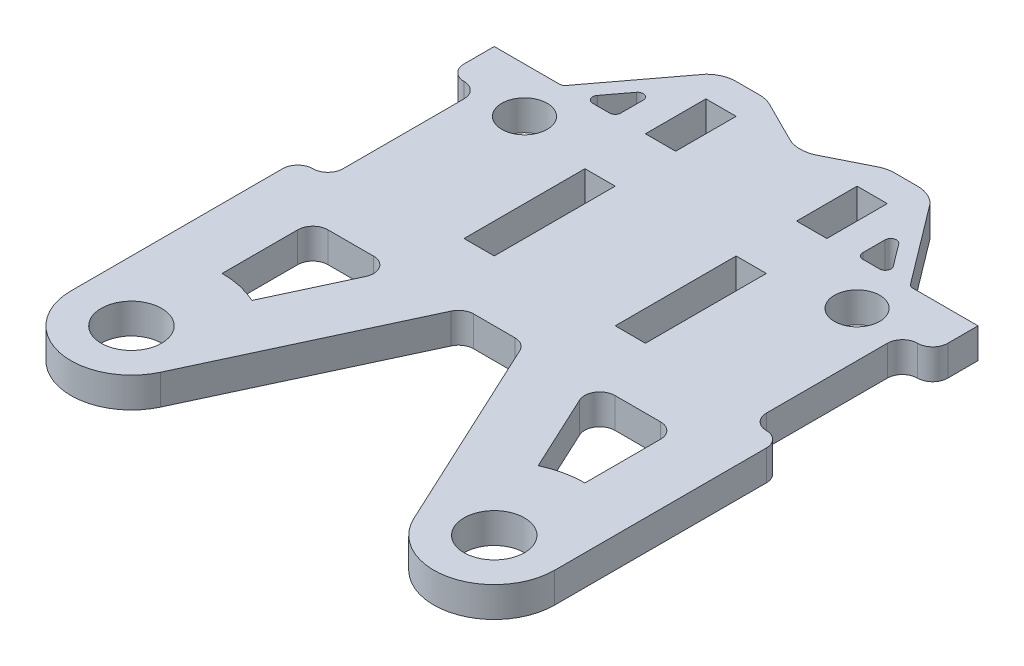
from build123d import *

# Parameters (mm, degrees)
SKETCH1_R           = 3.175
SKETCH1_W           = 3.175
SKETCH1_H           = 12.7
SKETCH1_H_2         = 6.35
BOSS_EXTRUDE1_DEPTH = 3.175
FILLET1_R           = 1.5875
SKETCH2_R           = 2.38125
CUT_EXTRUDE1_DEPTH  = 46.900442536
FILLET2_R           = 3.175
FILLET4_R           = 0.6


with BuildPart() as part:
    # Sketch1 → Boss-Extrude1 (new body)
    with BuildSketch(Plane(origin=(0, 0, 0), x_dir=(1, 0, 0), z_dir=(0, 1, 0))):
        with BuildLine():
            Line((25.4, -31.75), (25.4, -12.7))
            Line((25.4, -12.7), (25.4, -9.525))
            ThreePointArc((25.4, -9.525), (24.935032015, -8.402467985), (23.8125, -7.9375))
            ThreePointArc((23.8125, -7.9375), (22.689967985, -7.472532015), (22.225, -6.35))
            Line((22.225, -6.35), (22.225, 6.35))
            ThreePointArc((22.225, 6.35), (22.689967985, 7.472532015), (23.8125, 7.9375))
            ThreePointArc((23.8125, 7.9375), (24.935032015, 8.402467985), (25.4, 9.525))
            Line((25.4, 9.525), (25.4, 12.7))
            Line((25.4, 12.7), (23.8125, 12.7))
            Line((23.8125, 12.7), (18.25625, 12.7))
            Line((18.25625, 12.7), (11.77006403, 21.29506403))
            ThreePointArc((11.77006403, 21.29506403), (10.740019898, 21.983317516), (9.525, 22.225))
            Line((9.525, 22.225), (6.35, 22.225))
            Line((6.35, 22.225), (0, 19.05))
            Line((0, 19.05), (-6.35, 22.225))
            Line((-6.35, 22.225), (-9.525, 22.225))
            ThreePointArc((-9.525, 22.225), (-10.740019898, 21.983317516), (-11.77006403, 21.29506403))
            Line((-11.77006403, 21.29506403), (-18.25625, 12.7))
            Line((-18.25625, 12.7), (-23.8125, 12.7))
            Line((-23.8125, 12.7), (-25.4, 12.7))
            Line((-25.4, 12.7), (-25.4, 9.525))
            ThreePointArc((-25.4, 9.525), (-24.935032015, 8.402467985), (-23.8125, 7.9375))
            ThreePointArc((-23.8125, 7.9375), (-22.689967985, 7.472532015), (-22.225, 6.35))
            Line((-22.225, 6.35), (-22.225, -6.35))
            ThreePointArc((-22.225, -6.35), (-22.689967985, -7.472532015), (-23.8125, -7.9375))
            ThreePointArc((-23.8125, -7.9375), (-24.935032015, -8.402467985), (-25.4, -9.525))
            Line((-25.4, -9.525), (-25.4, -12.7))
            Line((-25.4, -12.7), (-25.4, -31.75))
            ThreePointArc((-25.4, -31.75), (-20.422679281, -37.949858998), (-13.293464066, -34.430446612))
            Line((-13.293464066, -34.430446612), (-3.175, -12.7))
            Line((-3.175, -12.7), (3.175, -12.7))
            Line((3.175, -12.7), (13.293464066, -34.430446612))
            ThreePointArc((13.293464066, -34.430446612), (20.422679281, -37.949858998), (25.4, -31.75))
        make_face()
        with Locations((-19.05, -31.75)):
            Circle(SKETCH1_R, mode=Mode.SUBTRACT)
        with BuildLine():
            Line((-19.05, -22.225), (-19.05, -12.7))
            Line((-19.05, -12.7), (-10.179646624, -12.7))
            Line((-10.179646624, -12.7), (-15.029330082, -23.115196099))
            ThreePointArc((-15.029330082, -23.115196099), (-16.990981078, -22.450211503), (-19.05, -22.225))
        make_face(mode=Mode.SUBTRACT)
        with Locations((19.05, -31.75)):
            Circle(SKETCH1_R, mode=Mode.SUBTRACT)
        with BuildLine():
            Line((15.029330082, -23.115196099), (10.179646624, -12.7))
            Line((10.179646624, -12.7), (19.05, -12.7))
            Line((19.05, -12.7), (19.05, -22.225))
            ThreePointArc((19.05, -22.225), (16.990981078, -22.450211503), (15.029330082, -23.115196099))
        make_face(mode=Mode.SUBTRACT)
        with Locations((-7.9375, 0)):
            Rectangle(SKETCH1_W, SKETCH1_H, mode=Mode.SUBTRACT)
        Polygon((-12.7, 17.427343025), (-12.7, 12.7), (-16.267445908, 12.7), align=None, mode=Mode.SUBTRACT)
        with Locations((-7.9375, 15.875)):
            Rectangle(SKETCH1_W, SKETCH1_H_2, mode=Mode.SUBTRACT)
        with Locations((7.9375, 0)):
            Rectangle(SKETCH1_W, SKETCH1_H, mode=Mode.SUBTRACT)
        with Locations((7.9375, 15.875)):
            Rectangle(SKETCH1_W, SKETCH1_H_2, mode=Mode.SUBTRACT)
        Polygon((12.7, 17.427343025), (16.267445908, 12.7), (12.7, 12.7), align=None, mode=Mode.SUBTRACT)
    extrude(amount=BOSS_EXTRUDE1_DEPTH)

    # Fillet1
    fillet1_edges = [part.edges().sort_by_distance(p)[0] for p in [
        (19.05, 1.5875, 12.7),
        (10.179646624, 1.5875, 12.7),
        (3.175, 1.5875, 12.7),
        (-3.175, 1.5875, 12.7),
        (-10.179646624, 1.5875, 12.7),
        (-19.05, 1.5875, 12.7),
    ]]
    fillet(fillet1_edges, radius=FILLET1_R)

    # Sketch2 → Cut-Extrude1 (cut, through all)
    with BuildSketch(Plane(origin=(0, 3.175, 0), x_dir=(1, 0, 0), z_dir=(0, 1, 0))):
        with Locations((-17.4625, 7.9375)):
            Circle(SKETCH2_R)
        with Locations((17.4625, 7.9375)):
            Circle(SKETCH2_R)
    extrude(amount=-CUT_EXTRUDE1_DEPTH, mode=Mode.SUBTRACT)

    # Fillet2
    fillet2_edges = [part.edges().sort_by_distance(p)[0] for p in [
        (6.35, 1.5875, -22.225),
        (0, 1.5875, -19.05),
        (-6.35, 1.5875, -22.225),
    ]]
    fillet(fillet2_edges, radius=FILLET2_R)

    # Fillet4
    fillet4_edges = [part.edges().sort_by_distance(p)[0] for p in [
        (12.7, 1.5875, -12.7),
        (12.7, 1.5875, -17.427343025),
        (-12.7, 1.5875, -17.427343025),
        (-16.267445908, 1.5875, -12.7),
        (-12.7, 1.5875, -12.7),
        (18.25625, 1.5875, -12.7),
        (16.267445908, 1.5875, -12.7),
        (-18.25625, 1.5875, -12.7),
    ]]
    fillet(fillet4_edges, radius=FILLET4_R)


solid = part.part
